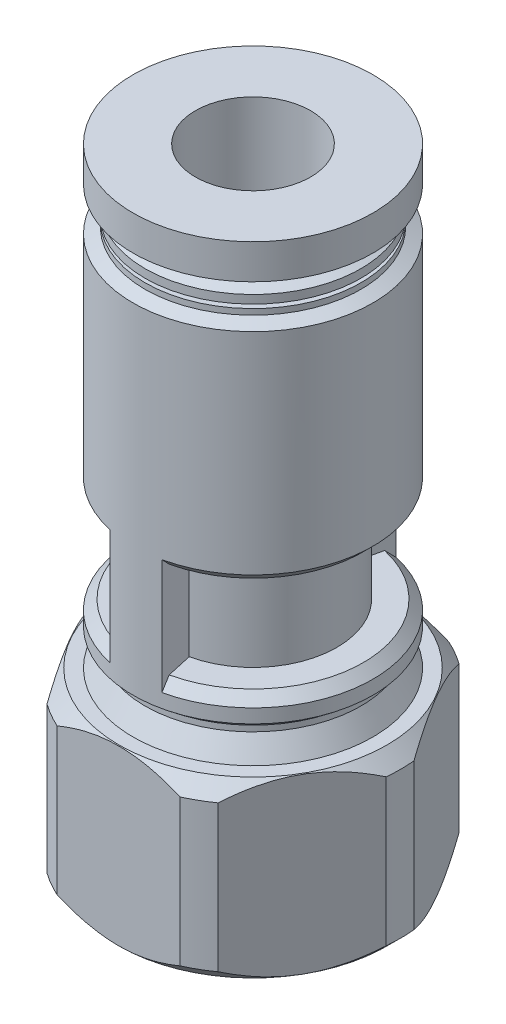
from build123d import *
from build123d.topology import SkipClean

# Parameters (mm, degrees)
SKETCH4_W                = 28
SKETCH4_H                = 28
CUT_EXTRUDE1_DEPTH       = 9.05
SKETCH5_W                = 2.5
SKETCH5_H                = 6
REVOLVE3_ANGLE           = 12.5
REVOLVE3_OTHER_WAY_ANGLE = 12.5
SKETCH6_W                = 2.5
SKETCH6_H                = 6
REVOLVE4_ANGLE           = 12.5
REVOLVE4_OTHER_WAY_ANGLE = 12.5
SKETCH7_R                = 1.5875
CUT_EXTRUDE2_DEPTH       = 38.666032443


with BuildPart() as part:
    # Sketch1 → Revolve1 (revolve)
    with BuildSketch(Plane.XY):
        Polygon((0, 0), (-7, 0), (-7.7, 0.7), (-7.7, 8.325), (-6.975, 9.05), (-6.25, 9.05), (-5.625, 10.136), (-5.625, 10.436), (-6.25, 10.936), (-6.25, 11.66), (-5.75, 12.16), (-4.375, 12.16), (-4.375, 17.16), (-5.75, 17.16), (-6.25, 17.66), (-6.25, 28.642), (-5.625, 28.942), (-5.625, 29.242), (-5, 29.242), (-5, 29.442), (-5.625, 29.442), (-5.625, 29.877538462), (-5, 30.166), (-3.6, 30.166), (-3.6, 30.89), (-6.25, 30.89), (-6.25, 32.7), (0, 32.7), align=None)
    revolve(axis=Axis((0, 32.7, 0), (0, -1, 0)))

    # Sketch2 → Revolve2 (revolve)
    with BuildSketch(Plane.XY):
        Polygon((0, -3.5), (-2.0095, -3.5), (-2.5, -3.0095), (-2.5, -0.5), (-4.2, -0.5), (-4.2, 0), (0, 0), align=None)
    revolve(axis=Axis((0, 0, 0), (0, -1, 0)))

    # Sketch3 → Cut-Revolve1 (revolve, cut)
    with BuildSketch(Plane.XY):
        Polygon((0, -3.5), (-1.25, -3.5), (-1.25, 1), (-3, 1), (-3, 32.7), (0, 32.7), align=None)
    revolve(axis=Axis((0, 32.7, 0), (0, -1, 0)), mode=Mode.SUBTRACT)

    # Sketch4 → Cut-Extrude1 (cut)
    with BuildSketch(Plane(origin=(0, 0, 0), x_dir=(-1, 0, 0), z_dir=(0, 1, 0))):
        Rectangle(SKETCH4_W, SKETCH4_H)
        Polygon((8.082903769, 0), (4.041451884, 7), (-4.041451884, 7), (-8.082903769, 0), (-4.041451884, -7), (4.041451884, -7), align=None, mode=Mode.SUBTRACT)
    extrude(amount=CUT_EXTRUDE1_DEPTH, mode=Mode.SUBTRACT)

    # Sketch5 → Revolve3 (revolve)
    with SkipClean():  # the faces are left unmerged after this step: merging them gives an invalid solid
        with BuildSketch(Plane(origin=(0, 0, 0), x_dir=(0, 0, -1), z_dir=(1, 0, 0))):
            with Locations((5, 14.66)):
                Rectangle(SKETCH5_W, SKETCH5_H)
        revolve(axis=Axis((0, 11.66, 0), (0, 1, 0)), revolution_arc=REVOLVE3_ANGLE)

    # Sketch5 → Revolve3 other way (revolve)
    with SkipClean():  # the faces are left unmerged after this step: merging them gives an invalid solid
        with BuildSketch(Plane(origin=(0, 0, 0), x_dir=(0, 0, -1), z_dir=(1, 0, 0))):
            with Locations((5, 14.66)):
                Rectangle(SKETCH5_W, SKETCH5_H)
        revolve(axis=Axis((0, 11.66, 0), (0, -1, 0)), revolution_arc=REVOLVE3_OTHER_WAY_ANGLE)

    # Sketch6 → Revolve4 (revolve)
    with SkipClean():  # the faces are left unmerged after this step: merging them gives an invalid solid
        with BuildSketch(Plane(origin=(0, 0, 0), x_dir=(0, 0, -1), z_dir=(1, 0, 0))):
            with Locations((-5, 14.66)):
                Rectangle(SKETCH6_W, SKETCH6_H)
        revolve(axis=Axis((0, 17.66, 0), (0, -1, 0)), revolution_arc=REVOLVE4_ANGLE)

    # Sketch6 → Revolve4 other way (revolve)
    with SkipClean():  # the faces are left unmerged after this step: merging them gives an invalid solid
        with BuildSketch(Plane(origin=(0, 0, 0), x_dir=(0, 0, -1), z_dir=(1, 0, 0))):
            with Locations((-5, 14.66)):
                Rectangle(SKETCH6_W, SKETCH6_H)
        revolve(axis=Axis((0, 17.66, 0), (0, 1, 0)), revolution_arc=REVOLVE4_OTHER_WAY_ANGLE)

    # Sketch7 → Cut-Extrude2 (cut, through all)
    with SkipClean():  # the faces are left unmerged after this step: merging them gives an invalid solid
        with BuildSketch(Plane.XZ.offset(3.5)):
            Circle(SKETCH7_R)
        extrude(amount=-CUT_EXTRUDE2_DEPTH, mode=Mode.SUBTRACT)


solid = part.part
